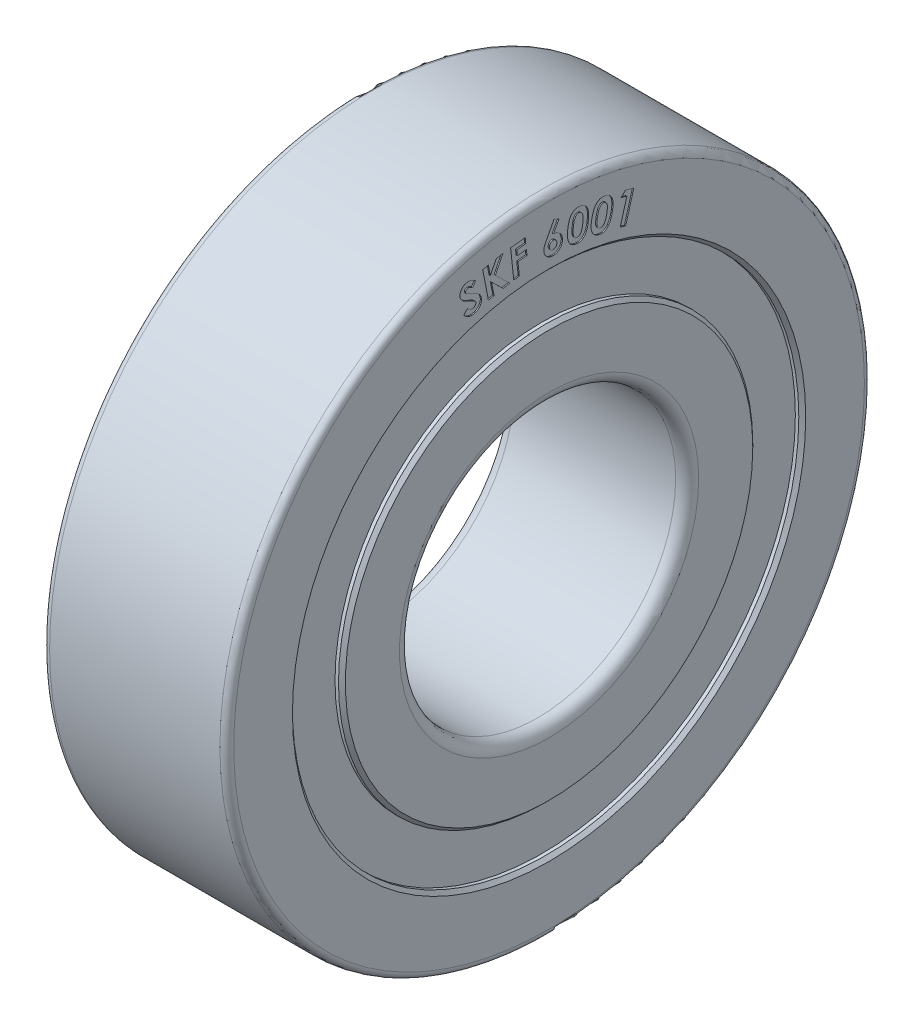
from build123d import *

# Parameters (mm, degrees)
PADR_OCIRCULAR2_COUNT    = 8
RESSALTO_EXTRUS_O1_START = 0.2
ESBO_O4_R                = 11.15
ESBO_O4_R_2              = 9
RESSALTO_EXTRUS_O1_DEPTH = 0.2
ESBO_O5_R                = 11
ESBO_O5_R_2              = 9
RESSALTO_EXTRUS_O2_DEPTH = 0.2
ENVOLVER1_START          = -0.05
ENVOLVER1_DEPTH          = 0.05


# Read off the part's stored shape, not the designer's step: Envolver1
with BuildPart() as part:
    # Esboço1 → Revolução1 (revolve)
    with BuildSketch(Plane.XY, mode=Mode.PRIVATE) as revolu_o1_sk:
        with BuildLine():
            Line((-7.85, 11), (-5.732050808, 11))
            ThreePointArc((-5.732050808, 11), (-4, 12), (-2.267949192, 11))
            Line((-2.267949192, 11), (-0.15, 11))
            Line((-0.15, 11), (0, 11.15))
            Line((0, 11.15), (0, 13.7))
            ThreePointArc((0, 13.7), (-0.087867966, 13.912132034), (-0.3, 14))
            Line((-0.3, 14), (-7.7, 14))
            ThreePointArc((-7.7, 14), (-7.912132034, 13.912132034), (-8, 13.7))
            Line((-8, 13.7), (-8, 11.15))
            Line((-8, 11.15), (-7.85, 11))
        make_face()
        with BuildLine():
            Line((-0.5, 6), (-7.5, 6))
            ThreePointArc((-7.5, 6), (-7.853553391, 6.146446609), (-8, 6.5))
            Line((-8, 6.5), (-8, 8.85))
            Line((-8, 8.85), (-7.85, 9))
            Line((-7.85, 9), (-5.732050808, 9))
            ThreePointArc((-5.732050808, 9), (-4, 8), (-2.267949192, 9))
            Line((-2.267949192, 9), (-0.15, 9))
            Line((-0.15, 9), (0, 8.85))
            Line((0, 8.85), (0, 6.5))
            ThreePointArc((0, 6.5), (-0.146446609, 6.146446609), (-0.5, 6))
        make_face()
    revolve(revolu_o1_sk.sketch.rotate(Axis((0, 0, 0), (-1, 0, 0)), 90), axis=Axis((0, 0, 0), (-1, 0, 0)))

    # Esboço4 → Ressalto-extrusão1 (add)
    with BuildSketch(Plane(origin=(-0.5, 0, 0), x_dir=(0, 0, -1), z_dir=(1, 0, 0)).offset(RESSALTO_EXTRUS_O1_START)):
        Circle(ESBO_O4_R)
        Circle(ESBO_O4_R_2, mode=Mode.SUBTRACT)
    extrude(amount=-RESSALTO_EXTRUS_O1_DEPTH)

    # Esboço5 → Ressalto-extrusão2 (add)
    with BuildSketch(Plane.ZY.offset(7.5)):
        with Locations(Location((0, 0, 0), (0, 0, 180))):
            Circle(ESBO_O5_R)
        with Locations(Location((0, 0, 0), (0, 0, 180))):
            Circle(ESBO_O5_R_2, mode=Mode.SUBTRACT)
    extrude(amount=RESSALTO_EXTRUS_O2_DEPTH)

    # Envolver1 outline → Envolver1 (cut)
    # profile 1 of 7: a face of its own
    with BuildSketch(Plane(origin=(0, 0, 0), x_dir=(0, 0, -1), z_dir=(1, 0, 0)).offset(ENVOLVER1_START)):
        with BuildLine():
            add(Edge.make_bspline(
                [(-3.322861192, 12.103271093), (-3.33331933, 12.111272223), (-3.353444189, 12.126668998), (-3.384537721, 12.145822762), (-3.414304908, 12.161455715), (-3.443026463, 12.173126691), (-3.470844017, 12.180658139), (-3.497668507, 12.183765968), (-3.523591566, 12.183384934), (-3.540005436, 12.179440331), (-3.548121608, 12.177489843)],
                knots=[0, 0, 0, 0, 0.160452189, 0.308762181, 0.444616019, 0.570003598, 0.686037548, 0.794734634, 0.898502362, 1, 1, 1, 1], degree=3))
            Line((-3.322861192, 12.103271093), (-3.192652858, 12.309260676))
            add(Edge.make_bspline(
                [(-3.610621608, 12.405094009), (-3.595160906, 12.409053939), (-3.564293925, 12.416959858), (-3.516715167, 12.421616958), (-3.468749889, 12.420850485), (-3.42853033, 12.415433855), (-3.395722364, 12.407862121), (-3.369832482, 12.399930955), (-3.34293148, 12.390003859), (-3.314726256, 12.378297947), (-3.285820222, 12.363792793), (-3.2555206, 12.347697033), (-3.224253575, 12.329440268), (-3.203370999, 12.316105068), (-3.192652858, 12.309260676)],
                knots=[0, 0, 0, 0, 0.107715795, 0.215052406, 0.321823356, 0.431325877, 0.488525103, 0.549203613, 0.614151939, 0.682240005, 0.755430231, 0.832581981, 0.91407143, 1, 1, 1, 1], degree=3))
            add(Edge.make_bspline(
                [(-3.861142442, 11.991031509), (-3.863859424, 12.001752356), (-3.86922561, 12.022926609), (-3.873713923, 12.055036692), (-3.87445715, 12.086913984), (-3.871856071, 12.118519077), (-3.865809207, 12.149941551), (-3.856349613, 12.18108272), (-3.843480112, 12.211937314), (-3.827398195, 12.242157647), (-3.808643917, 12.271128896), (-3.787115359, 12.29785866), (-3.76339049, 12.32209507), (-3.73744052, 12.344007088), (-3.708884638, 12.362908504), (-3.678291992, 12.379583666), (-3.645559843, 12.394230234), (-3.622426338, 12.401423419), (-3.610621608, 12.405094009)],
                knots=[0, 0, 0, 0, 0.061581059, 0.121625931, 0.180156225, 0.238868022, 0.297953025, 0.35807379, 0.419859564, 0.483890524, 0.548539348, 0.611826452, 0.674746693, 0.737219363, 0.800657779, 0.865147253, 0.931186379, 1, 1, 1, 1], degree=3))
            add(Edge.make_bspline(
                [(-3.412704942, 11.648583593), (-3.43279849, 11.657170428), (-3.471502511, 11.673710315), (-3.526466541, 11.698981574), (-3.576516668, 11.722867659), (-3.621151557, 11.746049375), (-3.660877786, 11.767800909), (-3.695334037, 11.788581589), (-3.724635678, 11.808275315), (-3.749206982, 11.827315903), (-3.769922526, 11.846466223), (-3.788871603, 11.865282167), (-3.805390744, 11.885189927), (-3.820410815, 11.905263689), (-3.833445208, 11.925910017), (-3.844754507, 11.946989778), (-3.853883487, 11.968768179), (-3.858725184, 11.983617741), (-3.861142442, 11.991031509)],
                knots=[0, 0, 0, 0, 0.112425141, 0.216552341, 0.311239944, 0.397736141, 0.475301552, 0.544239725, 0.60469235, 0.656870291, 0.703979134, 0.749773892, 0.794150591, 0.836939032, 0.878696388, 0.91965549, 0.959887333, 1, 1, 1, 1], degree=3))
            add(Edge.make_bspline(
                [(-3.181194525, 11.483739843), (-3.183617758, 11.49072236), (-3.188568313, 11.504987324), (-3.201317779, 11.524490794), (-3.217459134, 11.54305381), (-3.234221135, 11.557203821), (-3.250377027, 11.568512359), (-3.265501094, 11.577753733), (-3.28327904, 11.587957239), (-3.303770607, 11.59882432), (-3.327088459, 11.610277557), (-3.353145273, 11.622493706), (-3.381937091, 11.635501771), (-3.402183796, 11.64411023), (-3.412704942, 11.648583593)],
                knots=[0, 0, 0, 0, 0.075474737, 0.154191428, 0.236767433, 0.32696134, 0.378035398, 0.438746485, 0.508463052, 0.588034217, 0.676331517, 0.774600191, 0.882871603, 1, 1, 1, 1], degree=3))
            add(Edge.make_bspline(
                [(-3.291090358, 11.324104426), (-3.281397362, 11.327323022), (-3.262527669, 11.333588775), (-3.237229012, 11.348473332), (-3.215690596, 11.36700328), (-3.198440468, 11.388737015), (-3.185658227, 11.412186734), (-3.178021441, 11.436226501), (-3.176147545, 11.460509635), (-3.179505772, 11.47596686), (-3.181194525, 11.483739843)],
                knots=[0, 0, 0, 0, 0.142632623, 0.277667871, 0.407741651, 0.538291229, 0.663866693, 0.779547792, 0.889141085, 1, 1, 1, 1], degree=3))
            add(Edge.make_bspline(
                [(-3.545517442, 11.429312759), (-3.534325452, 11.418436058), (-3.512939491, 11.397652559), (-3.479362606, 11.370913463), (-3.446562392, 11.349220394), (-3.41413476, 11.333125503), (-3.382334769, 11.322347663), (-3.351119962, 11.317360745), (-3.320433532, 11.317181972), (-3.300846483, 11.321802823), (-3.291090358, 11.324104426)],
                knots=[0, 0, 0, 0, 0.161890228, 0.309344296, 0.44478239, 0.569282343, 0.684095854, 0.791773793, 0.896284489, 1, 1, 1, 1], degree=3))
            Line((-3.545517442, 11.429312759), (-3.709579942, 11.251448176))
            add(Edge.make_bspline(
                [(-3.230673692, 11.097541926), (-3.241668338, 11.094645022), (-3.263348172, 11.088932753), (-3.295932101, 11.082537934), (-3.328076612, 11.079071006), (-3.359656308, 11.077230495), (-3.390806527, 11.078530492), (-3.421506481, 11.081360773), (-3.451634752, 11.087404131), (-3.481426884, 11.095003115), (-3.510804464, 11.105649602), (-3.539988231, 11.11865237), (-3.568947712, 11.134370497), (-3.597650945, 11.152660207), (-3.625984061, 11.173589835), (-3.654298601, 11.19690176), (-3.682397318, 11.222891237), (-3.700393961, 11.241797765), (-3.709579942, 11.251448176)],
                knots=[0, 0, 0, 0, 0.063894384, 0.125990374, 0.186384248, 0.245487488, 0.303575273, 0.361439322, 0.418560287, 0.476069516, 0.534089656, 0.593927275, 0.655484327, 0.719093113, 0.785054931, 0.853328787, 0.925134991, 1, 1, 1, 1], degree=3))
            add(Edge.make_bspline(
                [(-2.951767442, 11.561344009), (-2.948486836, 11.54872204), (-2.942048052, 11.523949134), (-2.936680345, 11.486511054), (-2.93467828, 11.449883778), (-2.936788847, 11.41389665), (-2.942818742, 11.378530155), (-2.952740663, 11.343878901), (-2.96651517, 11.310013772), (-2.983501415, 11.27710777), (-3.004125385, 11.245952611), (-3.027574852, 11.216814713), (-3.054307847, 11.1904583), (-3.08396838, 11.166684551), (-3.116347381, 11.145231508), (-3.151704459, 11.126518402), (-3.18990948, 11.11015705), (-3.216872159, 11.101813027), (-3.230673692, 11.097541926)],
                knots=[0, 0, 0, 0, 0.064398246, 0.126393247, 0.186518606, 0.245382258, 0.304122321, 0.363452954, 0.423111384, 0.484502487, 0.546126903, 0.607422031, 0.668992684, 0.731224647, 0.794989827, 0.860616272, 0.928652898, 1, 1, 1, 1], degree=3))
            add(Edge.make_bspline(
                [(-3.166350775, 11.807437759), (-3.15163277, 11.798885436), (-3.123333235, 11.782441173), (-3.084816952, 11.755386063), (-3.051509793, 11.727778645), (-3.023693637, 11.698714936), (-3.000356806, 11.667854423), (-2.980486498, 11.634899104), (-2.963847819, 11.599304464), (-2.955833235, 11.574120048), (-2.951767442, 11.561344009)],
                knots=[0, 0, 0, 0, 0.151886084, 0.292044021, 0.419626732, 0.537455658, 0.650273809, 0.764288301, 0.880423604, 1, 1, 1, 1], degree=3))
            add(Edge.make_bspline(
                [(-3.372079942, 11.902750259), (-3.35872, 11.896829555), (-3.333386079, 11.885602363), (-3.297274581, 11.869928681), (-3.265678636, 11.855027693), (-3.237638352, 11.84284079), (-3.214083724, 11.831502997), (-3.194464633, 11.822222554), (-3.178996643, 11.814424992), (-3.170159064, 11.809541957), (-3.166350775, 11.807437759)],
                knots=[0, 0, 0, 0, 0.193302823, 0.366552366, 0.520692477, 0.655351976, 0.770921412, 0.866447655, 0.942449634, 1, 1, 1, 1], degree=3))
            add(Edge.make_bspline(
                [(-3.591871608, 12.012385676), (-3.587910948, 12.009644049), (-3.578733619, 12.003291367), (-3.562180874, 11.993842182), (-3.541217272, 11.982632019), (-3.515960844, 11.969760177), (-3.486223974, 11.955357377), (-3.452150067, 11.939307493), (-3.413731834, 11.921239476), (-3.386427794, 11.909119251), (-3.372079942, 11.902750259)],
                knots=[0, 0, 0, 0, 0.05875462, 0.136141539, 0.232342392, 0.34887373, 0.481987915, 0.635498956, 0.808460306, 1, 1, 1, 1], degree=3))
            add(Edge.make_bspline(
                [(-3.630413275, 12.065250259), (-3.62871792, 12.060114991), (-3.62531623, 12.0498112), (-3.616287045, 12.036111806), (-3.605529837, 12.023100987), (-3.596538322, 12.01604686), (-3.591871608, 12.012385676)],
                knots=[0, 0, 0, 0, 0.242587697, 0.486746371, 0.733614715, 1, 1, 1, 1], degree=3))
            add(Edge.make_bspline(
                [(-3.548121608, 12.177489843), (-3.555500791, 12.175021338), (-3.569668026, 12.170282074), (-3.588914033, 12.15978487), (-3.604710215, 12.146206342), (-3.617438634, 12.130771308), (-3.626450812, 12.114141452), (-3.632287265, 12.097641651), (-3.633834913, 12.081002475), (-3.631557583, 12.070518317), (-3.630413275, 12.065250259)],
                knots=[0, 0, 0, 0, 0.151633623, 0.291120223, 0.424478642, 0.555668838, 0.679202752, 0.791665545, 0.895316535, 1, 1, 1, 1], degree=3))
        make_face()
    # profile 2 of 7: a face of its own
    with BuildSketch(Plane(origin=(0, 0, 0), x_dir=(0, 0, -1), z_dir=(1, 0, 0)).offset(ENVOLVER1_START)):
        with BuildLine():
            add(Edge.make_bspline(
                [(0.192991789, 12.368891746), (0.206466774, 12.3682685), (0.232935625, 12.36704426), (0.271895071, 12.361018266), (0.309088705, 12.351033267), (0.34489545, 12.337787187), (0.378875218, 12.320421809), (0.411225019, 12.299438878), (0.442244508, 12.275106914), (0.47102696, 12.247117229), (0.497540293, 12.216671608), (0.520500568, 12.183991747), (0.539969546, 12.149670949), (0.555656628, 12.11352626), (0.567638892, 12.075639904), (0.575959719, 12.036044272), (0.58078115, 11.994708975), (0.580934514, 11.96656086), (0.581012622, 11.952225079)],
                knots=[0, 0, 0, 0, 0.063713381, 0.12515189, 0.18584643, 0.245427368, 0.305232405, 0.365764547, 0.427394471, 0.491217357, 0.555198235, 0.617905383, 0.679622613, 0.741349384, 0.803749882, 0.867065878, 0.932296907, 1, 1, 1, 1], degree=3))
            Line((0.192991789, 12.368891746), (0.425543872, 12.804829246))
            Line((0.425543872, 12.804829246), (0.218252205, 12.912902162))
            Line((0.218252205, 12.912902162), (-0.124195711, 12.267589662))
            add(Edge.make_bspline(
                [(-0.230185295, 11.962381329), (-0.229835709, 11.972377709), (-0.229134053, 11.992441453), (-0.22494491, 12.022519797), (-0.219130347, 12.052677523), (-0.211974939, 12.078026071), (-0.204825705, 12.099340682), (-0.197616991, 12.117431002), (-0.189052643, 12.137547891), (-0.179255644, 12.1598193), (-0.167248791, 12.183735597), (-0.154395487, 12.209945683), (-0.140053589, 12.238243283), (-0.129623791, 12.25754453), (-0.124195711, 12.267589662)],
                knots=[0, 0, 0, 0, 0.091834526, 0.184321163, 0.278629283, 0.373823385, 0.426026121, 0.485114764, 0.552655885, 0.626906893, 0.708581093, 0.79845566, 0.895108354, 1, 1, 1, 1], degree=3))
            add(Edge.make_bspline(
                [(0.171377205, 11.555089662), (0.157118769, 11.555690048), (0.129077522, 11.556870791), (0.087969707, 11.563213343), (0.048680033, 11.573349419), (0.011331761, 11.587462415), (-0.024067322, 11.605328832), (-0.05765611, 11.626781934), (-0.089206789, 11.652242711), (-0.118657156, 11.680941437), (-0.145224481, 11.712093975), (-0.168140533, 11.744858649), (-0.188008944, 11.778308679), (-0.203859268, 11.813082525), (-0.216312134, 11.848880122), (-0.224450741, 11.885868513), (-0.229703273, 11.92377269), (-0.230023592, 11.949429414), (-0.230185295, 11.962381329)],
                knots=[0, 0, 0, 0, 0.06735087, 0.132455083, 0.195986574, 0.258644554, 0.320606793, 0.382919223, 0.446489052, 0.511711879, 0.576848346, 0.63951169, 0.700324302, 0.760303663, 0.819674825, 0.878942595, 0.938888329, 1, 1, 1, 1], degree=3))
            add(Edge.make_bspline(
                [(0.581012622, 11.952225079), (0.580388404, 11.938403388), (0.579161848, 11.911244448), (0.573158631, 11.871333492), (0.563173365, 11.833149469), (0.54965263, 11.796549455), (0.532297, 11.761673638), (0.511328172, 11.728460504), (0.486784438, 11.696835328), (0.458728555, 11.667436603), (0.428401848, 11.640440643), (0.395830716, 11.617295057), (0.362218464, 11.597189465), (0.326777089, 11.581291614), (0.289949932, 11.569039791), (0.251679176, 11.560335988), (0.21194786, 11.555682448), (0.185017042, 11.555288957), (0.171377205, 11.555089662)],
                knots=[0, 0, 0, 0, 0.065337596, 0.128385146, 0.190257254, 0.251506418, 0.312398922, 0.373956248, 0.436795367, 0.501198252, 0.565705517, 0.628303276, 0.689707399, 0.750463021, 0.811417644, 0.872805329, 0.935578836, 1, 1, 1, 1], degree=3))
        make_face()
        with BuildLine():
            add(Edge.make_bspline(
                [(0.010700122, 11.964725079), (0.011113534, 11.95269279), (0.011919012, 11.929249511), (0.020770695, 11.895461559), (0.035914859, 11.864705589), (0.056699032, 11.837653786), (0.081421584, 11.814981641), (0.109153566, 11.798355256), (0.1390876, 11.78742991), (0.160000055, 11.786014934), (0.170595955, 11.785297996)],
                knots=[0, 0, 0, 0, 0.135219223, 0.263456251, 0.389768461, 0.518774038, 0.64538834, 0.765057115, 0.880959391, 1, 1, 1, 1], degree=3))
            add(Edge.make_bspline(
                [(0.175283455, 12.136339662), (0.164191933, 12.135959302), (0.142575943, 12.135218028), (0.111504697, 12.125832258), (0.083149549, 12.110523636), (0.058303511, 12.089066436), (0.037684461, 12.062996248), (0.022310794, 12.033155593), (0.013045771, 11.999890884), (0.011497259, 11.976675703), (0.010700122, 11.964725079)],
                knots=[0, 0, 0, 0, 0.125114442, 0.243832394, 0.363364088, 0.48735953, 0.612520219, 0.737264065, 0.864749778, 1, 1, 1, 1], degree=3))
            add(Edge.make_bspline(
                [(0.340127205, 11.959516746), (0.339804835, 11.971546101), (0.339179427, 11.994883435), (0.330623794, 12.028433859), (0.315758445, 12.058726932), (0.295053377, 12.085127297), (0.270196616, 12.107484227), (0.241332807, 12.123820868), (0.209300435, 12.13420055), (0.186821423, 12.135614113), (0.175283455, 12.136339662)],
                knots=[0, 0, 0, 0, 0.133416062, 0.258831427, 0.381363986, 0.505829574, 0.62953009, 0.750507065, 0.871940929, 1, 1, 1, 1], degree=3))
            add(Edge.make_bspline(
                [(0.170595955, 11.785297996), (0.181681914, 11.785697552), (0.20345419, 11.786482261), (0.235019513, 11.795784276), (0.263954461, 11.811461487), (0.290043855, 11.832860367), (0.311742376, 11.859214733), (0.328105664, 11.889563248), (0.337882744, 11.923516545), (0.339365595, 11.947300839), (0.340127205, 11.959516746)],
                knots=[0, 0, 0, 0, 0.122527748, 0.240638448, 0.360695103, 0.485077423, 0.612167221, 0.736523508, 0.864675231, 1, 1, 1, 1], degree=3))
        make_face(mode=Mode.SUBTRACT)
    # profile 3 of 7: a face of its own
    with BuildSketch(Plane(origin=(0, 0, 0), x_dir=(0, 0, -1), z_dir=(1, 0, 0)).offset(ENVOLVER1_START)):
        with BuildLine():
            add(Edge.make_bspline(
                [(1.70899858, 12.121430648), (1.70669303, 12.100755472), (1.702218671, 12.060631347), (1.693628295, 12.002334377), (1.683524641, 11.947787961), (1.672125397, 11.896950656), (1.65941452, 11.8498046), (1.645153109, 11.80642771), (1.629635249, 11.766584568), (1.612302207, 11.730521171), (1.593937694, 11.697595717), (1.574961374, 11.667086566), (1.554574201, 11.639308791), (1.533553227, 11.613734692), (1.511648045, 11.590525736), (1.488346005, 11.570301498), (1.464318021, 11.552163217), (1.439292721, 11.536425509), (1.412894143, 11.523320906), (1.385372944, 11.512417307), (1.35646436, 11.503704691), (1.326193701, 11.497605381), (1.294619394, 11.493360491), (1.261711789, 11.491612386), (1.227520815, 11.492143685), (1.204389489, 11.494120416), (1.19259233, 11.495128565)],
                knots=[0, 0, 0, 0, 0.067675635, 0.131337489, 0.191656317, 0.248109531, 0.300792029, 0.350445326, 0.39659394, 0.43979341, 0.480498758, 0.519204562, 0.556598277, 0.592503559, 0.626859461, 0.660279893, 0.692756327, 0.724726629, 0.756300331, 0.788499315, 0.820931517, 0.854384148, 0.888852451, 0.924490196, 0.961489402, 1, 1, 1, 1], degree=3))
            add(Edge.make_bspline(
                [(1.324883997, 12.840961898), (1.336363923, 12.839541899), (1.358913133, 12.836752694), (1.391900214, 12.830186734), (1.423432497, 12.821662184), (1.453539329, 12.810908777), (1.482229176, 12.798199751), (1.509459184, 12.783246196), (1.535204078, 12.766316282), (1.559589016, 12.747525764), (1.582295766, 12.726586174), (1.603541218, 12.703567556), (1.622942675, 12.678312992), (1.640867115, 12.651065731), (1.656632989, 12.621497562), (1.670967122, 12.589916882), (1.683752785, 12.556283291), (1.694749808, 12.520281357), (1.703913984, 12.481593927), (1.71077013, 12.439724413), (1.716075691, 12.394725197), (1.718751132, 12.346380156), (1.719503069, 12.294776234), (1.718114266, 12.239880754), (1.714750582, 12.181685715), (1.710953186, 12.141906108), (1.70899858, 12.121430648)],
                knots=[0, 0, 0, 0, 0.037477146, 0.073613716, 0.108895956, 0.143241655, 0.177117549, 0.210480286, 0.243796735, 0.276883171, 0.310131854, 0.343778032, 0.378270881, 0.413226375, 0.449350898, 0.486741367, 0.5255607, 0.565871183, 0.608654083, 0.654300741, 0.703292252, 0.755427313, 0.811133935, 0.870507914, 0.933347507, 1, 1, 1, 1], degree=3))
            add(Edge.make_bspline(
                [(0.96993608, 12.701899398), (0.981625675, 12.71469243), (1.004511502, 12.73973856), (1.043224061, 12.771748394), (1.08428465, 12.797903372), (1.127660201, 12.818644064), (1.173758166, 12.832855938), (1.222073555, 12.841799889), (1.272911957, 12.844654976), (1.307273093, 12.84221331), (1.324883997, 12.840961898)],
                knots=[0, 0, 0, 0, 0.130595614, 0.25567939, 0.377561947, 0.497064449, 0.617177095, 0.740340377, 0.866918238, 1, 1, 1, 1], degree=3))
            add(Edge.make_bspline(
                [(0.80821733, 12.201899398), (0.811424082, 12.230233366), (0.817621141, 12.284988866), (0.830893967, 12.363658314), (0.84694632, 12.435906969), (0.865565297, 12.501819657), (0.886974653, 12.561401211), (0.91150591, 12.614420504), (0.938251024, 12.661522549), (0.959623968, 12.688758484), (0.96993608, 12.701899398)],
                knots=[0, 0, 0, 0, 0.160580499, 0.310322413, 0.449101861, 0.57723776, 0.695866105, 0.805239258, 0.906030977, 1, 1, 1, 1], degree=3))
            add(Edge.make_bspline(
                [(1.19259233, 11.495128565), (1.180765282, 11.496545311), (1.157609994, 11.499319052), (1.123839981, 11.505878717), (1.091777104, 11.514381826), (1.06144876, 11.525160361), (1.032728595, 11.537678944), (1.005507701, 11.551901503), (0.980204067, 11.568489608), (0.956322386, 11.586733329), (0.934145256, 11.607166376), (0.913473713, 11.62955381), (0.894729741, 11.654302873), (0.877290021, 11.680817161), (0.861336805, 11.709348786), (0.847022452, 11.739908866), (0.834286403, 11.772545688), (0.823021664, 11.807375625), (0.813417562, 11.844974816), (0.80674306, 11.885954045), (0.801353243, 11.930248383), (0.79881902, 11.977995239), (0.797606276, 12.029071119), (0.799146148, 12.083623166), (0.802455843, 12.141644176), (0.806259501, 12.181423886), (0.80821733, 12.201899398)],
                knots=[0, 0, 0, 0, 0.039033166, 0.076420099, 0.112654628, 0.14766074, 0.18180876, 0.215282768, 0.248192137, 0.280858303, 0.313682694, 0.346909102, 0.380598867, 0.415321693, 0.450861422, 0.487645864, 0.525846769, 0.565617541, 0.607574469, 0.652901019, 0.701604251, 0.753766731, 0.809545697, 0.869028922, 0.932586237, 1, 1, 1, 1], degree=3))
        make_face()
        with BuildLine():
            add(Edge.make_bspline(
                [(1.051446497, 12.171691065), (1.049534272, 12.152173365), (1.045867665, 12.114749043), (1.043387236, 12.060691906), (1.042781582, 12.011268435), (1.044054514, 11.966210527), (1.04824465, 11.925681308), (1.054302053, 11.889498272), (1.062662864, 11.857806274), (1.073774742, 11.830543654), (1.086758615, 11.807000061), (1.10106556, 11.78647224), (1.116438272, 11.768376272), (1.133589147, 11.753497736), (1.151915534, 11.740975489), (1.171823421, 11.731678152), (1.193020519, 11.724936363), (1.207739358, 11.722787412), (1.21524858, 11.721691065)],
                knots=[0, 0, 0, 0, 0.110585456, 0.212042694, 0.305064371, 0.389320021, 0.466092123, 0.534665574, 0.596065927, 0.650521711, 0.700259724, 0.747384864, 0.79145892, 0.833782564, 0.875059815, 0.916229508, 0.957262168, 1, 1, 1, 1], degree=3))
            add(Edge.make_bspline(
                [(1.306915247, 12.608930648), (1.296837644, 12.609566973), (1.276921783, 12.61082451), (1.247316207, 12.606124031), (1.219033221, 12.596332356), (1.196820824, 12.583906062), (1.179970519, 12.571228758), (1.167685979, 12.559756304), (1.156256625, 12.546208813), (1.144927982, 12.531108869), (1.134456721, 12.513903249), (1.124142792, 12.495023219), (1.114632777, 12.474174102), (1.105425695, 12.451350455), (1.096801712, 12.426149209), (1.088780522, 12.398239068), (1.081311718, 12.367555026), (1.074217625, 12.33395607), (1.067819801, 12.297460819), (1.061928779, 12.258017185), (1.056021204, 12.215865455), (1.053002857, 12.186719622), (1.051446497, 12.171691065)],
                knots=[0, 0, 0, 0, 0.053599206, 0.105925415, 0.158221034, 0.212193123, 0.240554404, 0.270292794, 0.301405627, 0.334755873, 0.370645237, 0.408468115, 0.449181549, 0.492497555, 0.539387441, 0.590844039, 0.646971048, 0.70739627, 0.773541061, 0.844093584, 0.919609485, 1, 1, 1, 1], degree=3))
            add(Edge.make_bspline(
                [(1.465769414, 12.143826481), (1.467767353, 12.16403839), (1.471603843, 12.202849775), (1.474337769, 12.258902562), (1.475196738, 12.310232244), (1.474212488, 12.356935534), (1.470233714, 12.39892937), (1.464533316, 12.436255279), (1.456289271, 12.468932287), (1.445588426, 12.497117745), (1.432820731, 12.52136992), (1.419043307, 12.542631323), (1.403903119, 12.561152059), (1.387142752, 12.576518215), (1.369226939, 12.589334538), (1.349761987, 12.599107125), (1.32876945, 12.605585637), (1.314243308, 12.607809013), (1.306915247, 12.608930648)],
                knots=[0, 0, 0, 0, 0.112035084, 0.215132422, 0.309485896, 0.395241738, 0.472677923, 0.542040204, 0.603368831, 0.658243724, 0.707938283, 0.754294834, 0.797829626, 0.839515601, 0.879376332, 0.918997571, 0.95913638, 1, 1, 1, 1], degree=3))
            add(Edge.make_bspline(
                [(1.365508997, 11.794868148), (1.371722048, 11.803848217), (1.384702387, 11.822609424), (1.400581844, 11.855022566), (1.415408925, 11.891731822), (1.42853514, 11.933215512), (1.440121218, 11.97925247), (1.450640773, 12.029866109), (1.458995317, 12.085280652), (1.463457646, 12.123846793), (1.465769414, 12.143826481)],
                knots=[0, 0, 0, 0, 0.089200476, 0.186358086, 0.294332024, 0.412879711, 0.541851485, 0.682480032, 0.835504676, 1, 1, 1, 1], degree=3))
            add(Edge.make_bspline(
                [(1.21524858, 11.721691065), (1.222537705, 11.721251337), (1.236790938, 11.720391489), (1.257965118, 11.722166099), (1.278212339, 11.727225441), (1.297529807, 11.735122639), (1.316131643, 11.745645439), (1.333459821, 11.75944233), (1.350454735, 11.775645883), (1.360369538, 11.78830575), (1.365508997, 11.794868148)],
                knots=[0, 0, 0, 0, 0.124715865, 0.243870738, 0.361547563, 0.480026125, 0.599651221, 0.725491783, 0.857705304, 1, 1, 1, 1], degree=3))
        make_face(mode=Mode.SUBTRACT)
    # profile 4 of 7: a face of its own
    with BuildSketch(Plane(origin=(0, 0, 0), x_dir=(0, 0, -1), z_dir=(1, 0, 0)).offset(ENVOLVER1_START)):
        with BuildLine():
            add(Edge.make_bspline(
                [(2.748804473, 11.929900559), (2.744677269, 11.909473995), (2.736642718, 11.869708999), (2.7228412, 11.812208162), (2.708060266, 11.758508541), (2.692244165, 11.708696105), (2.675278299, 11.662738201), (2.657506162, 11.620434838), (2.638182676, 11.582170519), (2.618048028, 11.547439873), (2.596809897, 11.516077046), (2.574913629, 11.487450216), (2.552566986, 11.461102248), (2.528959388, 11.437817371), (2.505156726, 11.416368371), (2.47994072, 11.398303002), (2.454420117, 11.382202977), (2.42794631, 11.36877269), (2.400378027, 11.358205709), (2.37198971, 11.34942776), (2.342313497, 11.343495278), (2.311566627, 11.339981138), (2.279631419, 11.33825645), (2.246562067, 11.339494921), (2.212360058, 11.342785873), (2.189406935, 11.346843389), (2.177710723, 11.348910975)],
                knots=[0, 0, 0, 0, 0.067556761, 0.131514743, 0.191666234, 0.248092773, 0.300893158, 0.350446785, 0.396762035, 0.43976822, 0.4805124, 0.519462807, 0.556580783, 0.592400083, 0.626895931, 0.660332015, 0.692817787, 0.724659652, 0.756381904, 0.788432018, 0.820884861, 0.854325682, 0.888700784, 0.924459228, 0.961506724, 1, 1, 1, 1], degree=3))
            add(Edge.make_bspline(
                [(2.427450306, 12.683025559), (2.438779746, 12.68068703), (2.461116007, 12.676076565), (2.493364044, 12.666178446), (2.524283657, 12.655138562), (2.553510806, 12.641889359), (2.580956851, 12.626298911), (2.607038322, 12.609266501), (2.631323027, 12.590071287), (2.654167956, 12.569284068), (2.674919618, 12.546158387), (2.694397884, 12.521488946), (2.711537125, 12.494429627), (2.726956666, 12.465565156), (2.740150801, 12.434539168), (2.751968482, 12.401826642), (2.761503623, 12.366964767), (2.769411787, 12.330039027), (2.775130142, 12.290550976), (2.778441639, 12.248104797), (2.77939688, 12.202639384), (2.778014873, 12.153977975), (2.774302118, 12.102291235), (2.768315658, 12.047464984), (2.759573923, 11.989665569), (2.752461643, 11.950196003), (2.748804473, 11.929900559)],
                knots=[0, 0, 0, 0, 0.037321677, 0.073580581, 0.10877139, 0.143254524, 0.177002361, 0.210575258, 0.243703212, 0.276820499, 0.310144584, 0.343886603, 0.378164207, 0.413387352, 0.449407279, 0.486896874, 0.525579038, 0.565971964, 0.608729259, 0.654267994, 0.70331625, 0.755452753, 0.811350881, 0.870545288, 0.933433755, 1, 1, 1, 1], degree=3))
            add(Edge.make_bspline(
                [(2.060523223, 12.574952642), (2.073267377, 12.586747628), (2.098254401, 12.609873652), (2.139815389, 12.638256927), (2.183090722, 12.661065862), (2.228525137, 12.677430066), (2.275720749, 12.688394868), (2.324841477, 12.692497776), (2.375825234, 12.691457057), (2.409959865, 12.685882129), (2.427450306, 12.683025559)],
                knots=[0, 0, 0, 0, 0.130397068, 0.255665051, 0.377093545, 0.497247437, 0.61772522, 0.740265718, 0.866913249, 1, 1, 1, 1], degree=3))
            add(Edge.make_bspline(
                [(1.85531489, 12.089275559), (1.861058545, 12.117368385), (1.87213774, 12.171557902), (1.892131436, 12.249048331), (1.914514763, 12.319800051), (1.938827046, 12.384104361), (1.965460547, 12.441751657), (1.99446574, 12.492679198), (2.025442505, 12.537255647), (2.049117842, 12.562696662), (2.060523223, 12.574952642)],
                knots=[0, 0, 0, 0, 0.160955549, 0.310474406, 0.449028249, 0.577362618, 0.696182581, 0.80510359, 0.906110405, 1, 1, 1, 1], degree=3))
            add(Edge.make_bspline(
                [(2.177710723, 11.348910975), (2.166042339, 11.351362589), (2.143133597, 11.356175886), (2.109985284, 11.365871531), (2.078721413, 11.377389452), (2.049057492, 11.390283914), (2.021556446, 11.405462736), (1.995678908, 11.422211199), (1.971852757, 11.441009946), (1.949444383, 11.46135987), (1.929171269, 11.483869891), (1.910588438, 11.508151765), (1.893953921, 11.534378122), (1.878688419, 11.562301458), (1.865564567, 11.592366403), (1.853765083, 11.624147761), (1.843890091, 11.657916258), (1.835776104, 11.693727551), (1.829715679, 11.732163967), (1.826192067, 11.7736679), (1.82499012, 11.81843855), (1.826021525, 11.866419065), (1.829848001, 11.917580155), (1.835890849, 11.971945281), (1.844161408, 12.029645649), (1.851520264, 12.068988335), (1.85531489, 12.089275559)],
                knots=[0, 0, 0, 0, 0.038936398, 0.076444508, 0.112685815, 0.147723571, 0.181985153, 0.215173931, 0.248299663, 0.281011407, 0.313932628, 0.347109291, 0.380774315, 0.415284914, 0.450956019, 0.487827446, 0.525959504, 0.565788057, 0.607697029, 0.652956047, 0.701747399, 0.753933086, 0.809650651, 0.869270551, 0.9325888, 1, 1, 1, 1], degree=3))
        make_face()
        with BuildLine():
            add(Edge.make_bspline(
                [(2.095679473, 12.037452642), (2.092155863, 12.018117557), (2.085394307, 11.981014914), (2.077858333, 11.927245134), (2.072644413, 11.877826086), (2.070713172, 11.832707831), (2.070466797, 11.791880408), (2.074064147, 11.755342781), (2.079311233, 11.722840555), (2.088168111, 11.694556007), (2.098874475, 11.669775963), (2.111476136, 11.647998968), (2.125558438, 11.628797273), (2.141293481, 11.612242199), (2.158540239, 11.598232411), (2.177575761, 11.587264068), (2.19812511, 11.57867073), (2.212715455, 11.575346431), (2.22015864, 11.573650559)],
                knots=[0, 0, 0, 0, 0.110463374, 0.211971297, 0.305143348, 0.389648137, 0.465769208, 0.534375464, 0.595825616, 0.650462447, 0.700502447, 0.747286732, 0.791593156, 0.83404442, 0.875347217, 0.916019755, 0.957157935, 1, 1, 1, 1], degree=3))
            add(Edge.make_bspline(
                [(2.389429473, 12.452556809), (2.379382409, 12.453942807), (2.359581409, 12.456674367), (2.32952721, 12.454755701), (2.300376905, 12.44729484), (2.27191006, 12.434583397), (2.244362022, 12.415414506), (2.219173183, 12.387983588), (2.195262453, 12.353498998), (2.177134566, 12.31944249), (2.163432036, 12.287999576), (2.152678969, 12.260982808), (2.142591096, 12.230860357), (2.132851275, 12.197790964), (2.122793861, 12.161928849), (2.113676734, 12.123009788), (2.10405371, 12.081340684), (2.098532328, 12.052404), (2.095679473, 12.037452642)],
                knots=[0, 0, 0, 0, 0.053669381, 0.105772925, 0.15845655, 0.212426977, 0.270261805, 0.335040509, 0.408710237, 0.492306677, 0.539080977, 0.590527972, 0.646412843, 0.707419901, 0.773292821, 0.843837351, 0.919311979, 1, 1, 1, 1], degree=3))
            add(Edge.make_bspline(
                [(2.507398223, 11.973650559), (2.511125856, 11.993675073), (2.5182869, 12.032143571), (2.525908464, 12.087961125), (2.531669319, 12.139253938), (2.534376028, 12.186114263), (2.534215846, 12.228390735), (2.531476614, 12.266185496), (2.526236889, 12.299541097), (2.518202497, 12.328759616), (2.50738558, 12.353953925), (2.495890037, 12.376610583), (2.482290301, 12.396387501), (2.466739724, 12.41305561), (2.450014466, 12.427524916), (2.43123799, 12.438646412), (2.411082704, 12.447547981), (2.396706332, 12.450873525), (2.389429473, 12.452556809)],
                knots=[0, 0, 0, 0, 0.111971417, 0.215104953, 0.309658952, 0.395699219, 0.473017708, 0.541944171, 0.603850864, 0.658395027, 0.708030642, 0.754354911, 0.797911765, 0.839455803, 0.879420914, 0.919036828, 0.959019034, 1, 1, 1, 1], degree=3))
            add(Edge.make_bspline(
                [(2.376669056, 11.633546392), (2.383647939, 11.64198908), (2.398262975, 11.659669589), (2.416963509, 11.690635135), (2.435084667, 11.726005134), (2.45167591, 11.766360164), (2.46770801, 11.811316154), (2.482027399, 11.861138514), (2.495668425, 11.915671222), (2.503387145, 11.953824163), (2.507398223, 11.973650559)],
                knots=[0, 0, 0, 0, 0.089163387, 0.186724191, 0.293980945, 0.412886508, 0.541992877, 0.682802955, 0.835166732, 1, 1, 1, 1], degree=3))
            add(Edge.make_bspline(
                [(2.22015864, 11.573650559), (2.227343688, 11.572468792), (2.241480401, 11.570143643), (2.262816084, 11.570604012), (2.283509414, 11.573650997), (2.303562491, 11.579791118), (2.323061292, 11.588721833), (2.341798306, 11.600847154), (2.359944877, 11.615833167), (2.370975779, 11.627516421), (2.376669056, 11.633546392)],
                knots=[0, 0, 0, 0, 0.123876656, 0.243729564, 0.361954997, 0.479437451, 0.599927928, 0.726340973, 0.858758881, 1, 1, 1, 1], degree=3))
        make_face(mode=Mode.SUBTRACT)
    # profile 5 of 7: a face of its own
    with BuildSketch(Plane(origin=(0, 0, 0), x_dir=(0, 0, -1), z_dir=(1, 0, 0)).offset(ENVOLVER1_START)):
        Polygon((-2.554738027, 12.170489806), (-2.640415111, 12.60694814), (-2.884685944, 12.559031473), (-2.635727611, 11.290021056), (-2.391456777, 11.337937723), (-2.501873444, 11.901218973), (-2.000050527, 11.41476064), (-1.713592194, 11.47101064), (-2.337810944, 12.078562723), (-2.005519277, 12.731427306), (-2.296404694, 12.674396056), align=None)
    # profile 6 of 7: a face of its own
    with BuildSketch(Plane(origin=(0, 0, 0), x_dir=(0, 0, -1), z_dir=(1, 0, 0)).offset(ENVOLVER1_START)):
        Polygon((-1.010469701, 12.605964336), (-1.036250951, 12.843724753), (-1.671928034, 12.77445392), (-1.532865534, 11.493464336), (-1.291719701, 11.51976642), (-1.354219701, 12.09632892), (-0.959688451, 12.13929767), (-0.985209284, 12.373412253), (-1.379740534, 12.330443503), (-1.405000951, 12.562995586), align=None)
    # profile 7 of 7: a face of its own
    with BuildSketch(Plane(origin=(0, 0, 0), x_dir=(0, 0, -1), z_dir=(1, 0, 0)).offset(ENVOLVER1_START)):
        Polygon((3.324636266, 11.102737759), (3.679323766, 12.347789843), (3.324636266, 12.448831509), (3.124375849, 12.265237759), (3.380886266, 12.192060676), (3.089480016, 11.169664843), align=None)
    extrude(amount=ENVOLVER1_DEPTH, mode=Mode.SUBTRACT)


with BuildPart() as body_2:
    # Esboço3 → Revolução2 (revolve)
    with BuildSketch(Plane(origin=(0, 0, 0), x_dir=(1, 0, 0), z_dir=(0, 1, 0))):
        with BuildLine():
            Line((-4, 8), (-4, 12))
            ThreePointArc((-4, 12), (-6, 10), (-4, 8))
        make_face()
    revolve(axis=Axis((-4, 0, -8), (0, 0, -1)))


with BuildPart() as padr_ocircular2_1:
    # PadrãoCircular2: pattern copy
    add(body_2.part.rotate(Axis((0, 0, 0), (1, 0, 0)), 1 * 360 / PADR_OCIRCULAR2_COUNT))


with BuildPart() as padr_ocircular2_2:
    # PadrãoCircular2: pattern copy
    add(body_2.part.rotate(Axis((0, 0, 0), (1, 0, 0)), 2 * 360 / PADR_OCIRCULAR2_COUNT))


with BuildPart() as padr_ocircular2_3:
    # PadrãoCircular2: pattern copy
    add(body_2.part.rotate(Axis((0, 0, 0), (1, 0, 0)), 3 * 360 / PADR_OCIRCULAR2_COUNT))


with BuildPart() as padr_ocircular2_4:
    # PadrãoCircular2: pattern copy
    add(body_2.part.rotate(Axis((0, 0, 0), (1, 0, 0)), 4 * 360 / PADR_OCIRCULAR2_COUNT))


with BuildPart() as padr_ocircular2_5:
    # PadrãoCircular2: pattern copy
    add(body_2.part.rotate(Axis((0, 0, 0), (1, 0, 0)), 5 * 360 / PADR_OCIRCULAR2_COUNT))


with BuildPart() as padr_ocircular2_6:
    # PadrãoCircular2: pattern copy
    add(body_2.part.rotate(Axis((0, 0, 0), (1, 0, 0)), 6 * 360 / PADR_OCIRCULAR2_COUNT))


with BuildPart() as padr_ocircular2_7:
    # PadrãoCircular2: pattern copy
    add(body_2.part.rotate(Axis((0, 0, 0), (1, 0, 0)), 7 * 360 / PADR_OCIRCULAR2_COUNT))


solid = Compound([part.part, body_2.part, padr_ocircular2_1.part, padr_ocircular2_2.part, padr_ocircular2_3.part, padr_ocircular2_4.part, padr_ocircular2_5.part, padr_ocircular2_6.part, padr_ocircular2_7.part])
